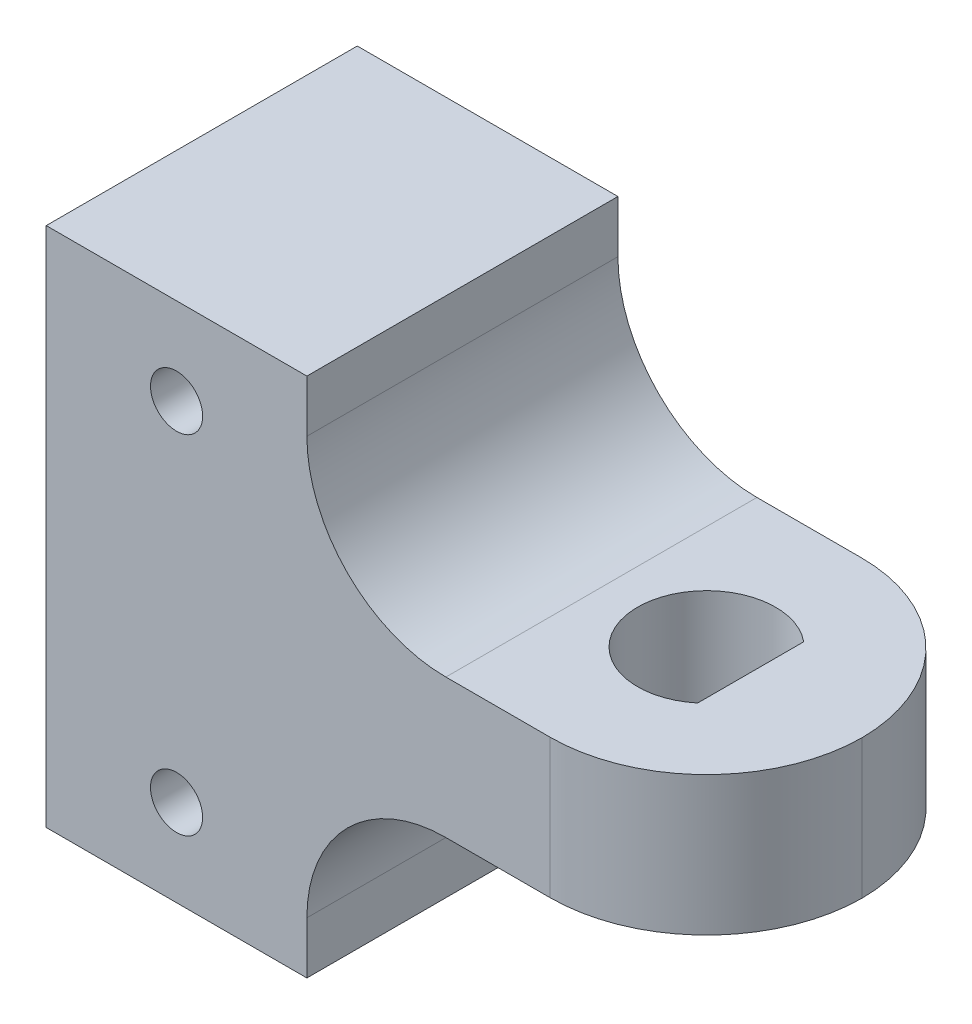
from build123d import *

# Parameters (mm, degrees)
BOSS_EXTRU_1_DEPTH      = 17.9
CONG_1_R                = 9
ENL_V_MAT_EXTRU_1_REACH = 42.145
ENL_V_MAT_EXTRU_2_REACH = 40.414
ESQUISSE3_R             = 1.5
CONG_2_R                = 8


with BuildPart() as part:
    # Esquisse1 → Boss.-Extru.1 (new body)
    with BuildSketch(Plane.XY):
        Polygon((7.5, 4), (30.5, 4), (30.5, -4), (7.5, -4), (7.5, -15), (-7.5, -15), (-7.5, 15), (7.5, 15), align=None)
    extrude(amount=BOSS_EXTRU_1_DEPTH)

    # Congé1
    # the kernel refuses this fillet: 9 mm, written as the material it takes off along each edge
    with BuildSketch(Plane(origin=(30.5, 26.5, 0), x_dir=(0, 0, 1), z_dir=(0, -1, 0))) as cong_1_piece_1:
        with BuildLine():
            CenterArc((CONG_1_R, CONG_1_R), CONG_1_R, 180, 90)
            Line((0, CONG_1_R), (0, 0))
            Line((0, 0), (CONG_1_R, 0))
        make_face()
    extrude(amount=53, mode=Mode.SUBTRACT)
    with BuildSketch(Plane(origin=(30.5, 26.5, 17.9), x_dir=(0, 0, -1), z_dir=(0, -1, 0))) as cong_1_piece_2:
        with BuildLine():
            CenterArc((CONG_1_R, -CONG_1_R), CONG_1_R, 90, 90)
            Line((0, -CONG_1_R), (0, 0))
            Line((0, 0), (CONG_1_R, 0))
        make_face()
    extrude(amount=53, mode=Mode.SUBTRACT)

    # Esquisse2 → Enlèv. mat.-Extru.1 (cut, up to next)
    with BuildSketch(Plane(origin=(0, 4, 0), x_dir=(1, 0, 0), z_dir=(0, 1, 0)), mode=Mode.PRIVATE) as enl_v_mat_extru_1_sk1:
        with BuildLine():
            Line((24.04, -5.84888545), (24.04, -11.95111455))
            ThreePointArc((24.04, -11.95111455), (17.53, -8.9), (24.04, -5.84888545))
        make_face()
    enl_v_mat_extru_1_tool1 = extrude(enl_v_mat_extru_1_sk1.sketch, amount=-ENL_V_MAT_EXTRU_1_REACH, mode=Mode.PRIVATE) & part.part
    add(enl_v_mat_extru_1_tool1.solids().sort_by_distance((21.06418, 4, 8.9))[0], mode=Mode.SUBTRACT)

    # Esquisse3 → Enlèv. mat.-Extru.2 (cut, up to next)
    with BuildSketch(Plane.XY.offset(17.9), mode=Mode.PRIVATE) as enl_v_mat_extru_2_sk1:
        with Locations((0, 10)):
            Circle(ESQUISSE3_R)
    enl_v_mat_extru_2_tool1 = extrude(enl_v_mat_extru_2_sk1.sketch, amount=-ENL_V_MAT_EXTRU_2_REACH, mode=Mode.PRIVATE) & part.part
    # Esquisse3 → Enlèv. mat.-Extru.2 (cut, up to next)
    with BuildSketch(Plane.XY.offset(17.9), mode=Mode.PRIVATE) as enl_v_mat_extru_2_sk2:
        with Locations((0, -10)):
            Circle(ESQUISSE3_R)
    enl_v_mat_extru_2_tool2 = extrude(enl_v_mat_extru_2_sk2.sketch, amount=-ENL_V_MAT_EXTRU_2_REACH, mode=Mode.PRIVATE) & part.part
    add(enl_v_mat_extru_2_tool1.solids().sort_by_distance((0, 10, 17.9))[0], mode=Mode.SUBTRACT)
    add(enl_v_mat_extru_2_tool2.solids().sort_by_distance((0, -10, 17.9))[0], mode=Mode.SUBTRACT)

    # Congé2
    cong_2_edges = [part.edges().sort_by_distance(p)[0] for p in [
        (7.5, 4, 8.95),
        (7.5, -4, 8.95),
    ]]
    fillet(cong_2_edges, radius=CONG_2_R)


solid = part.part
